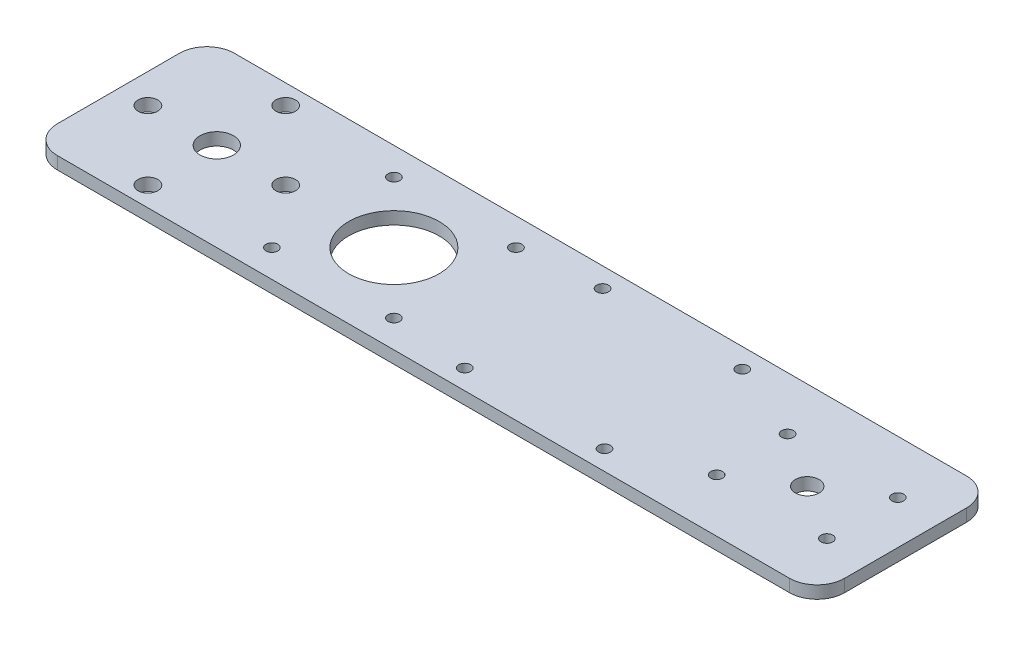
from build123d import *

# Parameters (mm, degrees)
SKETCH1_W           = 200
SKETCH1_H           = 45
BOSS_EXTRUDE1_DEPTH = 3.175
SKETCH4_R           = 3
SKETCH4_R_2         = 1.5
CUT_EXTRUDE1_DEPTH  = 177.469064215
SKETCH5_R           = 4.25
CUT_EXTRUDE2_DEPTH  = 177.469064215
SKETCH6_R           = 11.5
SKETCH6_R_2         = 1.5
CUT_EXTRUDE3_DEPTH  = 177.469064215
SKETCH10_R          = 1.5
CUT_EXTRUDE4_DEPTH  = 177.469064215
FILLET1_R           = 7
SKETCH11_R          = 2.5
CUT_EXTRUDE5_DEPTH  = 177.469064215


with BuildPart() as part:
    # Sketch1 → Boss-Extrude1 (new body)
    with BuildSketch(Plane(origin=(0, 0, 0), x_dir=(1, 0, 0), z_dir=(0, 1, 0))):
        with Locations((75, 0)):
            Rectangle(SKETCH1_W, SKETCH1_H)
    extrude(amount=BOSS_EXTRUDE1_DEPTH)

    # Sketch4 → Cut-Extrude1 (cut, through all)
    with BuildSketch(Plane(origin=(0, 3.175, 0), x_dir=(1, 0, 0), z_dir=(0, 1, 0))):
        with Locations((150, 0)):
            Circle(SKETCH4_R)
        with Locations((136, 9)):
            Circle(SKETCH4_R_2)
        with Locations((164, 9)):
            Circle(SKETCH4_R_2)
        with Locations((164, -9)):
            Circle(SKETCH4_R_2)
        with Locations((136, -9)):
            Circle(SKETCH4_R_2)
    extrude(amount=-CUT_EXTRUDE1_DEPTH, mode=Mode.SUBTRACT)

    # Sketch5 → Cut-Extrude2 (cut, through all)
    with BuildSketch(Plane(origin=(0, 3.175, 0), x_dir=(1, 0, 0), z_dir=(0, 1, 0))):
        Circle(SKETCH5_R)
    extrude(amount=-CUT_EXTRUDE2_DEPTH, mode=Mode.SUBTRACT)

    # Sketch6 → Cut-Extrude3 (cut, through all)
    with BuildSketch(Plane(origin=(0, 3.175, 0), x_dir=(1, 0, 0), z_dir=(0, 1, 0))):
        with Locations((45, 0)):
            Circle(SKETCH6_R)
        with Locations((29.5, 15.5)):
            Circle(SKETCH6_R_2)
        with Locations((60.5, 15.5)):
            Circle(SKETCH6_R_2)
        with Locations((60.5, -15.5)):
            Circle(SKETCH6_R_2)
        with Locations((29.5, -15.5)):
            Circle(SKETCH6_R_2)
    extrude(amount=-CUT_EXTRUDE3_DEPTH, mode=Mode.SUBTRACT)

    # Sketch10 → Cut-Extrude4 (cut, through all)
    with BuildSketch(Plane(origin=(0, 3.175, 0), x_dir=(1, 0, 0), z_dir=(0, 1, 0))):
        with Locations((80.5, -17.5)):
            Circle(SKETCH10_R)
        with Locations((116, -17.5)):
            Circle(SKETCH10_R)
        with Locations((116, 17.5)):
            Circle(SKETCH10_R)
        with Locations((80.5, 17.5)):
            Circle(SKETCH10_R)
    extrude(amount=-CUT_EXTRUDE4_DEPTH, mode=Mode.SUBTRACT)

    # Fillet1
    fillet1_edges = [part.edges().sort_by_distance(p)[0] for p in [
        (-25, 1.5875, 22.5),
        (-25, 1.5875, -22.5),
        (175, 1.5875, -22.5),
        (175, 1.5875, 22.5),
    ]]
    fillet(fillet1_edges, radius=FILLET1_R)

    # Sketch11 → Cut-Extrude5 (cut, through all)
    with BuildSketch(Plane(origin=(0, 3.175, 0), x_dir=(1, 0, 0), z_dir=(0, 1, 0))):
        with Locations((0, 17.5)):
            Circle(SKETCH11_R)
        with Locations((17.5, 0)):
            Circle(SKETCH11_R)
        with Locations((0, -17.5)):
            Circle(SKETCH11_R)
        with Locations((-17.5, 0)):
            Circle(SKETCH11_R)
    extrude(amount=-CUT_EXTRUDE5_DEPTH, mode=Mode.SUBTRACT)


solid = part.part
